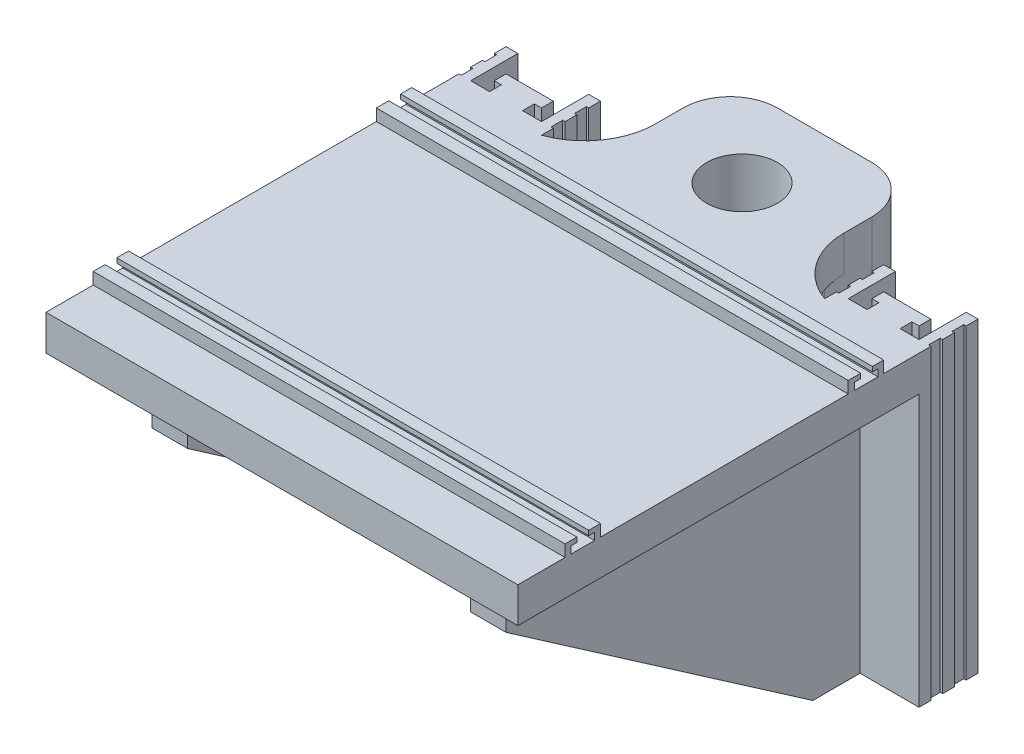
from build123d import *

# Parameters (mm, degrees)
EXTRUDE_1_DEPTH     = 130
EXTRUDE_1_2_DEPTH   = 130
SKETCH_3_W          = 1
SKETCH_3_H          = 5
CUT_EXTRUDE_3_DEPTH = 166.227116419
SKETCH_5_W          = 200
SKETCH_5_H          = 15
EXTRUDE_2_DEPTH     = 170
SKETCH_6_W          = 15
SKETCH_6_H          = 115
EXTRUDE_3_DEPTH     = 150
CUT_EXTRUDE_4_DEPTH = 280.55321497
SKETCH_8_W          = 80
SKETCH_8_H          = 60
SKETCH_8_R          = 15
EXTRUDE_4_DEPTH     = 30
FILLET_1_R          = 30
FILLET_3_R          = 20
SKETCH_9_W          = 200
SKETCH_9_H          = 15
EXTRUDE_5_DEPTH     = 5
SKETCH_10_W         = 200
SKETCH_10_H         = 5
CUT_EXTRUDE_5_DEPTH = 2
SKETCH_11_W         = 200
SKETCH_11_H         = 10
CUT_EXTRUDE_6_DEPTH = 3


with BuildPart() as part:
    # 草图1 → 凸台-拉伸1 (new body)
    with BuildSketch(Plane(origin=(0, 0, 0), x_dir=(1, 0, 0), z_dir=(0, 1, 0))):
        Polygon((-60, 0), (-60, 20), (-65, 20), (-65, 0), (-73, 0), (-73, 5), (-70, 5), (-70, 10), (-90, 10), (-90, 5), (-87, 5), (-87, 0), (-95, 0), (-95, 20), (-100, 20), (-100, -5), (-60, -5), align=None)
    extrude(amount=EXTRUDE_1_DEPTH)


with BuildPart() as body_2:
    # 草图1 → Extrude 1 2 (new body)
    with BuildSketch(Plane(origin=(0, 0, 0), x_dir=(1, 0, 0), z_dir=(0, 1, 0))):
        Polygon((73, 0), (73, 5), (70, 5), (70, 10), (90, 10), (90, 5), (87, 5), (87, 0), (95, 0), (95, 20), (100, 20), (100, -5), (60, -5), (60, 0), (60, 20), (65, 20), (65, 0), align=None)
    extrude(amount=EXTRUDE_1_2_DEPTH)


with BuildPart() as cut_extrude_3_tool:
    # 草图3 → 切除-拉伸3 (new, through all)
    with BuildSketch(Plane(origin=(0, 130, 0), x_dir=(1, 0, 0), z_dir=(0, 1, 0))):
        with Locations((-99.5, 12.5)):
            Rectangle(SKETCH_3_W, SKETCH_3_H)
        with Locations((-99.5, 2.5)):
            Rectangle(SKETCH_3_W, SKETCH_3_H)
        with Locations((-60.5, 12.5)):
            Rectangle(SKETCH_3_W, SKETCH_3_H)
        with Locations((-60.5, 2.5)):
            Rectangle(SKETCH_3_W, SKETCH_3_H)
        with Locations((60.5, 2.5)):
            Rectangle(SKETCH_3_W, SKETCH_3_H)
        with Locations((60.5, 12.5)):
            Rectangle(SKETCH_3_W, SKETCH_3_H)
        with Locations((99.5, 2.5)):
            Rectangle(SKETCH_3_W, SKETCH_3_H)
        with Locations((99.5, 12.5)):
            Rectangle(SKETCH_3_W, SKETCH_3_H)
    extrude(amount=-CUT_EXTRUDE_3_DEPTH)


with BuildPart() as part_1:
    add(part.part)

    # 切除-拉伸3: cut by cut_extrude_3_tool
    add(cut_extrude_3_tool.part, mode=Mode.SUBTRACT)



with BuildPart() as body_2_1:
    add(body_2.part)

    # 切除-拉伸3: cut by cut_extrude_3_tool
    add(cut_extrude_3_tool.part, mode=Mode.SUBTRACT)


with BuildPart() as part_2:
    add(part_1.part)

    add(body_2_1.part)  # 凸台-拉伸2 merges body 2
    # 草图5 → 凸台-拉伸2 (add)
    with BuildSketch(Plane.XY.offset(5)):
        with Locations((0, 122.5)):
            Rectangle(SKETCH_5_W, SKETCH_5_H)
    extrude(amount=EXTRUDE_2_DEPTH)

    # 草图6 → 凸台-拉伸3 (add)
    with BuildSketch(Plane.XY.offset(5)):
        with Locations((-67.5, 57.5)):
            Rectangle(SKETCH_6_W, SKETCH_6_H)
        with Locations((67.5, 57.5)):
            Rectangle(SKETCH_6_W, SKETCH_6_H)
    extrude(amount=EXTRUDE_3_DEPTH)

    # 草图7 → 切除-拉伸4 (cut, through all)
    with BuildSketch(Plane.ZY.offset(75)):
        Polygon((25, 0), (155, 90), (155, 0), align=None)
    extrude(amount=-CUT_EXTRUDE_4_DEPTH, mode=Mode.SUBTRACT)

    # 草图8 → 凸台-拉伸4 (add)
    with BuildSketch(Plane(origin=(0, 130, 0), x_dir=(1, 0, 0), z_dir=(0, 1, 0))):
        with Locations((0, 25)):
            Rectangle(SKETCH_8_W, SKETCH_8_H)
        with Locations(Location((0, 20, 0), (0, 0, 270))):
            Circle(SKETCH_8_R, mode=Mode.SUBTRACT)
    extrude(amount=-EXTRUDE_4_DEPTH)

    # 圆角1
    # the kernel refuses this fillet: 30 mm, written as the material it adds along each edge
    with BuildSketch(Plane(origin=(40, 130, 5), x_dir=(1, 0, 0), z_dir=(0, -1, 0))) as fillet_1_piece_1:
        with BuildLine():
            CenterArc((30, -28.284271247), FILLET_1_R, 109.471220634, 70.528779366)
            Line((0, -28.284271247), (0, 0))
            Line((0, 0), (20, 0))
        make_face()
    extrude(amount=15)
    with BuildSketch(Plane(origin=(-40, 130, 5), x_dir=(-1, 0, 0), z_dir=(0, -1, 0))) as fillet_1_piece_2:
        with BuildLine():
            CenterArc((30, 28.284271247), FILLET_1_R, 180, 70.528779366)
            Line((0, 28.284271247), (0, 0))
            Line((0, 0), (20, 0))
        make_face()
    extrude(amount=15)

    # 圆角3
    fillet_3_edges = [part_2.edges().sort_by_distance(p)[0] for p in [
        (40, 107.5, 5),
        (-40, 107.5, 5),
        (-40, 115, -55),
        (40, 115, -55),
    ]]
    fillet(fillet_3_edges, radius=FILLET_3_R)

    # 草图9 → 凸台-拉伸5 (add)
    with BuildSketch(Plane(origin=(0, 130, 0), x_dir=(1, 0, 0), z_dir=(0, 1, 0))):
        with Locations((0, -147.5)):
            Rectangle(SKETCH_9_W, SKETCH_9_H)
        with Locations((0, -27.5)):
            Rectangle(SKETCH_9_W, SKETCH_9_H)
    extrude(amount=EXTRUDE_5_DEPTH)

    # 草图10 → 切除-拉伸5 (cut)
    with BuildSketch(Plane(origin=(0, 135, 0), x_dir=(1, 0, 0), z_dir=(0, 1, 0))):
        with Locations((0, -27.241970949)):
            Rectangle(SKETCH_10_W, SKETCH_10_H)
        with Locations((0, -147.5)):
            Rectangle(SKETCH_10_W, SKETCH_10_H)
    extrude(amount=-CUT_EXTRUDE_5_DEPTH, mode=Mode.SUBTRACT)

    # 草图11 → 切除-拉伸6 (cut)
    with BuildSketch(Plane(origin=(0, 133, 0), x_dir=(1, 0, 0), z_dir=(0, 1, 0))):
        with Locations((0, -27.370985475)):
            Rectangle(SKETCH_11_W, SKETCH_11_H)
        with Locations((0, -147.5)):
            Rectangle(SKETCH_11_W, SKETCH_11_H)
    extrude(amount=-CUT_EXTRUDE_6_DEPTH, mode=Mode.SUBTRACT)


solid = part_2.part
